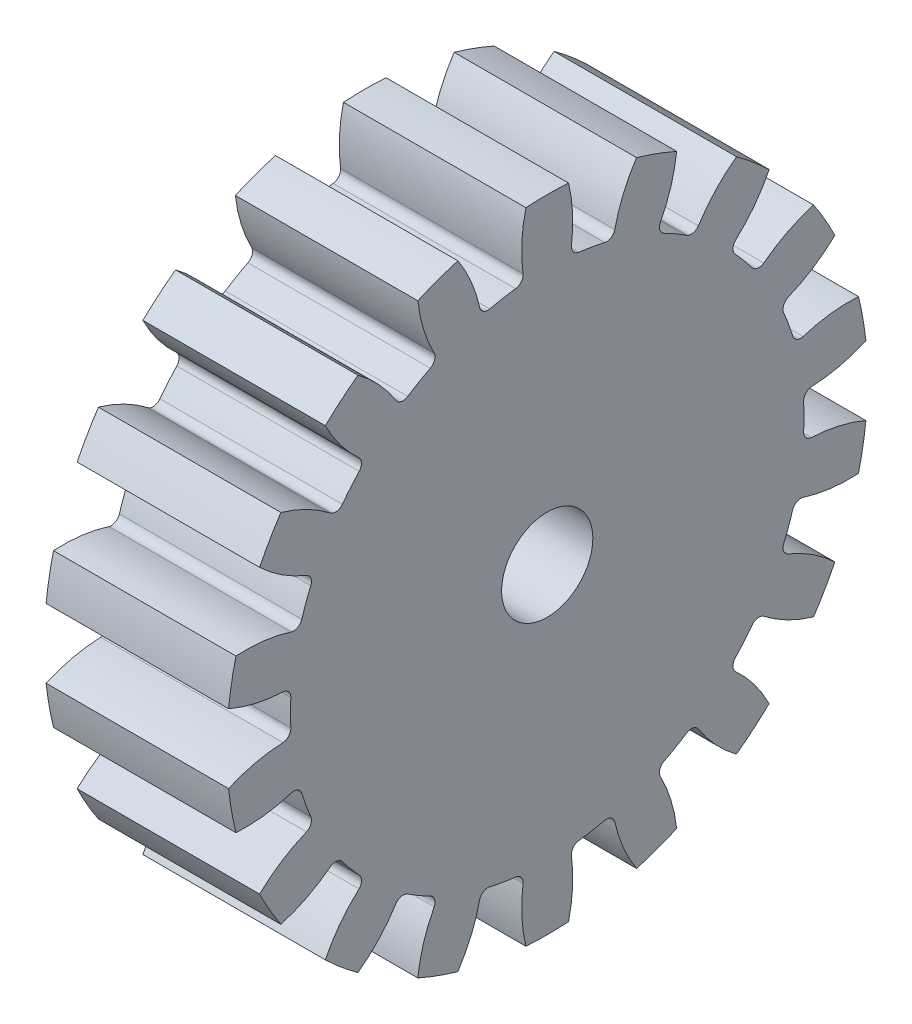
from build123d import *

# Parameters (mm, degrees)
SKETCH1_R           = 1.5
BOSS_EXTRUDE1_DEPTH = 6


with BuildPart() as part:
    # Sketch1 → Boss-Extrude1 (new body)
    with BuildSketch(Plane(origin=(-5.0626, 0, 0), x_dir=(0, -1, 0), z_dir=(-1, 0, 0))):
        with BuildLine():
            ThreePointArc((-5.090436848, -6.736072198), (-4.982381604, -6.916745301), (-5.030440693, -7.121706345))
            ThreePointArc((-5.030440693, -7.121706345), (-5.524579292, -7.900906047), (-5.865718199, -8.758197931))
            ThreePointArc((-5.865718199, -8.758197931), (-5.2705, -9.128773781), (-4.6519628, -9.458959938))
            ThreePointArc((-4.6519628, -9.458959938), (-4.079758863, -8.735097447), (-3.652358267, -7.917342605))
            ThreePointArc((-3.652358267, -7.917342605), (-3.49888634, -7.773241691), (-3.288391221, -7.776483726))
            ThreePointArc((-3.288391221, -7.776483726), (-2.887736164, -7.933989905), (-2.479573564, -8.070869278))
            ThreePointArc((-2.479573564, -8.070869278), (-2.316241008, -8.203689389), (-2.291300974, -8.412726947))
            ThreePointArc((-2.291300974, -8.412726947), (-2.489137375, -9.313940511), (-2.516491996, -10.236207747))
            ThreePointArc((-2.516491996, -10.236207747), (-1.830425441, -10.380858525), (-1.136260282, -10.479579838))
            ThreePointArc((-1.136260282, -10.479579838), (-0.846140018, -9.603666324), (-0.724203459, -8.68904852))
            ThreePointArc((-0.724203459, -8.68904852), (-0.629272437, -8.501147464), (-0.430362886, -8.43220041))
            ThreePointArc((-0.430362886, -8.43220041), (0, -8.443175704), (0.430362886, -8.43220041))
            ThreePointArc((0.430362886, -8.43220041), (0.629272437, -8.501147464), (0.724203459, -8.68904852))
            ThreePointArc((0.724203459, -8.68904852), (0.846531245, -9.60357629), (1.136260282, -10.479579838))
            ThreePointArc((1.136260282, -10.479579838), (1.830425441, -10.380858525), (2.516491996, -10.236207747))
            ThreePointArc((2.516491996, -10.236207747), (2.489535802, -9.313891307), (2.291300974, -8.412726947))
            ThreePointArc((2.291300974, -8.412726947), (2.316241008, -8.203689389), (2.479573564, -8.070869278))
            ThreePointArc((2.479573564, -8.070869278), (2.887736164, -7.933989905), (3.288391221, -7.776483726))
            ThreePointArc((3.288391221, -7.776483726), (3.49888634, -7.773241691), (3.652358267, -7.917342605))
            ThreePointArc((3.652358267, -7.917342605), (4.080095703, -8.734879036), (4.6519628, -9.458959938))
            ThreePointArc((4.6519628, -9.458959938), (5.2705, -9.128773781), (5.865718199, -8.758197931))
            ThreePointArc((5.865718199, -8.758197931), (5.524936862, -7.90072354), (5.030440693, -7.121706345))
            ThreePointArc((5.030440693, -7.121706345), (4.982381604, -6.916745301), (5.090436848, -6.736072198))
            ThreePointArc((5.090436848, -6.736072198), (5.427168729, -6.46784783), (5.749791043, -6.182808336))
            ThreePointArc((5.749791043, -6.182808336), (5.946482912, -6.107768249), (6.139984764, -6.190688324))
            ThreePointArc((6.139984764, -6.190688324), (6.821540404, -6.812626456), (7.606569949, -7.29744987))
            ThreePointArc((7.606569949, -7.29744987), (8.074874475, -6.775624194), (8.507452219, -6.223820188))
            ThreePointArc((8.507452219, -6.223820188), (7.893948997, -5.534611912), (7.162835023, -4.971702853))
            ThreePointArc((7.162835023, -4.971702853), (7.047573447, -4.795539649), (7.087318321, -4.588805397))
            ThreePointArc((7.087318321, -4.588805397), (7.312004648, -4.221587852), (7.517681208, -3.843395012))
            ThreePointArc((7.517681208, -3.843395012), (7.676845884, -3.705607815), (7.887038483, -3.717345667))
            ThreePointArc((7.887038483, -3.717345667), (8.740206657, -4.068670582), (9.643712501, -4.255759649))
            ThreePointArc((9.643712501, -4.255759649), (9.905299916, -3.605234331), (10.123061945, -2.938757877))
            ThreePointArc((10.123061945, -2.938757877), (9.310834381, -2.500944406), (8.431285738, -2.222038623))
            ThreePointArc((8.431285738, -2.222038623), (8.26272392, -2.09592114), (8.229364607, -1.888060942))
            ThreePointArc((8.229364607, -1.888060942), (8.314904893, -1.466142075), (8.378828069, -1.040411528))
            ThreePointArc((8.378828069, -1.040411528), (8.481267944, -0.85649639), (8.68279896, -0.79563626))
            ThreePointArc((8.68279896, -0.79563626), (9.604674995, -0.833972989), (10.517681, -0.700762007))
            ThreePointArc((10.517681, -0.700762007), (10.541, 0), (10.517681, 0.700762007))
            ThreePointArc((10.517681, 0.700762007), (9.604695725, 0.834373906), (8.68279896, 0.79563626))
            ThreePointArc((8.68279896, 0.79563626), (8.481267944, 0.85649639), (8.378828069, 1.040411528))
            ThreePointArc((8.378828069, 1.040411528), (8.314904893, 1.466142075), (8.229364607, 1.888060942))
            ThreePointArc((8.229364607, 1.888060942), (8.26272392, 2.09592114), (8.431285738, 2.222038623))
            ThreePointArc((8.431285738, 2.222038623), (9.310677779, 2.501314055), (10.123061945, 2.938757877))
            ThreePointArc((10.123061945, 2.938757877), (9.905299916, 3.605234331), (9.643712501, 4.255759649))
            ThreePointArc((9.643712501, 4.255759649), (8.740089015, 4.069054411), (7.887038483, 3.717345667))
            ThreePointArc((7.887038483, 3.717345667), (7.676845884, 3.705607815), (7.517681208, 3.843395012))
            ThreePointArc((7.517681208, 3.843395012), (7.312004648, 4.221587852), (7.087318321, 4.588805397))
            ThreePointArc((7.087318321, 4.588805397), (7.047573447, 4.795539649), (7.162835023, 4.971702853))
            ThreePointArc((7.162835023, 4.971702853), (7.893675412, 5.534905708), (8.507452219, 6.223820188))
            ThreePointArc((8.507452219, 6.223820188), (8.074874475, 6.775624194), (7.606569949, 7.29744987))
            ThreePointArc((7.606569949, 7.29744987), (6.821298579, 6.812946901), (6.139984764, 6.190688324))
            ThreePointArc((6.139984764, 6.190688324), (5.946482912, 6.107768249), (5.749791043, 6.182808336))
            ThreePointArc((5.749791043, 6.182808336), (5.427168729, 6.46784783), (5.090436848, 6.736072198))
            ThreePointArc((5.090436848, 6.736072198), (4.982381604, 6.916745301), (5.030440693, 7.121706345))
            ThreePointArc((5.030440693, 7.121706345), (5.524579292, 7.900906047), (5.865718199, 8.758197931))
            ThreePointArc((5.865718199, 8.758197931), (5.2705, 9.128773781), (4.6519628, 9.458959938))
            ThreePointArc((4.6519628, 9.458959938), (4.079758863, 8.735097447), (3.652358267, 7.917342605))
            ThreePointArc((3.652358267, 7.917342605), (3.49888634, 7.773241691), (3.288391221, 7.776483726))
            ThreePointArc((3.288391221, 7.776483726), (2.887736164, 7.933989905), (2.479573564, 8.070869278))
            ThreePointArc((2.479573564, 8.070869278), (2.316241008, 8.203689389), (2.291300974, 8.412726947))
            ThreePointArc((2.291300974, 8.412726947), (2.489137375, 9.313940511), (2.516491996, 10.236207747))
            ThreePointArc((2.516491996, 10.236207747), (1.830425441, 10.380858525), (1.136260282, 10.479579838))
            ThreePointArc((1.136260282, 10.479579838), (0.846140018, 9.603666324), (0.724203459, 8.68904852))
            ThreePointArc((0.724203459, 8.68904852), (0.629272437, 8.501147464), (0.430362886, 8.43220041))
            ThreePointArc((0.430362886, 8.43220041), (0, 8.443175704), (-0.430362886, 8.43220041))
            ThreePointArc((-0.430362886, 8.43220041), (-0.629272437, 8.501147464), (-0.724203459, 8.68904852))
            ThreePointArc((-0.724203459, 8.68904852), (-0.846531245, 9.60357629), (-1.136260282, 10.479579838))
            ThreePointArc((-1.136260282, 10.479579838), (-1.830425441, 10.380858525), (-2.516491996, 10.236207747))
            ThreePointArc((-2.516491996, 10.236207747), (-2.489535802, 9.313891307), (-2.291300974, 8.412726947))
            ThreePointArc((-2.291300974, 8.412726947), (-2.316241008, 8.203689389), (-2.479573564, 8.070869278))
            ThreePointArc((-2.479573564, 8.070869278), (-2.887736164, 7.933989905), (-3.288391221, 7.776483726))
            ThreePointArc((-3.288391221, 7.776483726), (-3.49888634, 7.773241691), (-3.652358267, 7.917342605))
            ThreePointArc((-3.652358267, 7.917342605), (-4.080095703, 8.734879036), (-4.6519628, 9.458959938))
            ThreePointArc((-4.6519628, 9.458959938), (-5.2705, 9.128773781), (-5.865718199, 8.758197931))
            ThreePointArc((-5.865718199, 8.758197931), (-5.524936862, 7.90072354), (-5.030440693, 7.121706345))
            ThreePointArc((-5.030440693, 7.121706345), (-4.982381604, 6.916745301), (-5.090436848, 6.736072198))
            ThreePointArc((-5.090436848, 6.736072198), (-5.427168729, 6.46784783), (-5.749791043, 6.182808336))
            ThreePointArc((-5.749791043, 6.182808336), (-5.946482912, 6.107768249), (-6.139984764, 6.190688324))
            ThreePointArc((-6.139984764, 6.190688324), (-6.821540404, 6.812626456), (-7.606569949, 7.29744987))
            ThreePointArc((-7.606569949, 7.29744987), (-8.074874475, 6.775624194), (-8.507452219, 6.223820188))
            ThreePointArc((-8.507452219, 6.223820188), (-7.893948997, 5.534611912), (-7.162835023, 4.971702853))
            ThreePointArc((-7.162835023, 4.971702853), (-7.047573447, 4.795539649), (-7.087318321, 4.588805397))
            ThreePointArc((-7.087318321, 4.588805397), (-7.312004648, 4.221587852), (-7.517681208, 3.843395012))
            ThreePointArc((-7.517681208, 3.843395012), (-7.676845884, 3.705607815), (-7.887038483, 3.717345667))
            ThreePointArc((-7.887038483, 3.717345667), (-8.740206657, 4.068670582), (-9.643712501, 4.255759649))
            ThreePointArc((-9.643712501, 4.255759649), (-9.905299916, 3.605234331), (-10.123061945, 2.938757877))
            ThreePointArc((-10.123061945, 2.938757877), (-9.310834381, 2.500944406), (-8.431285738, 2.222038623))
            ThreePointArc((-8.431285738, 2.222038623), (-8.26272392, 2.09592114), (-8.229364607, 1.888060942))
            ThreePointArc((-8.229364607, 1.888060942), (-8.314904893, 1.466142075), (-8.378828069, 1.040411528))
            ThreePointArc((-8.378828069, 1.040411528), (-8.481267944, 0.85649639), (-8.68279896, 0.79563626))
            ThreePointArc((-8.68279896, 0.79563626), (-9.604674995, 0.833972989), (-10.517681, 0.700762007))
            ThreePointArc((-10.517681, 0.700762007), (-10.541, 0), (-10.517681, -0.700762007))
            ThreePointArc((-10.517681, -0.700762007), (-9.604695725, -0.834373906), (-8.68279896, -0.79563626))
            ThreePointArc((-8.68279896, -0.79563626), (-8.481267944, -0.85649639), (-8.378828069, -1.040411528))
            ThreePointArc((-8.378828069, -1.040411528), (-8.314904893, -1.466142075), (-8.229364607, -1.888060942))
            ThreePointArc((-8.229364607, -1.888060942), (-8.26272392, -2.09592114), (-8.431285738, -2.222038623))
            ThreePointArc((-8.431285738, -2.222038623), (-9.310677779, -2.501314055), (-10.123061945, -2.938757877))
            ThreePointArc((-10.123061945, -2.938757877), (-9.905299916, -3.605234331), (-9.643712501, -4.255759649))
            ThreePointArc((-9.643712501, -4.255759649), (-8.740089015, -4.069054411), (-7.887038483, -3.717345667))
            ThreePointArc((-7.887038483, -3.717345667), (-7.676845884, -3.705607815), (-7.517681208, -3.843395012))
            ThreePointArc((-7.517681208, -3.843395012), (-7.312004648, -4.221587852), (-7.087318321, -4.588805397))
            ThreePointArc((-7.087318321, -4.588805397), (-7.047573447, -4.795539649), (-7.162835023, -4.971702853))
            ThreePointArc((-7.162835023, -4.971702853), (-7.893675412, -5.534905708), (-8.507452219, -6.223820188))
            ThreePointArc((-8.507452219, -6.223820188), (-8.074874475, -6.775624194), (-7.606569949, -7.29744987))
            ThreePointArc((-7.606569949, -7.29744987), (-6.821298579, -6.812946901), (-6.139984764, -6.190688324))
            ThreePointArc((-6.139984764, -6.190688324), (-5.946482912, -6.107768249), (-5.749791043, -6.182808336))
            ThreePointArc((-5.749791043, -6.182808336), (-5.427168729, -6.46784783), (-5.090436848, -6.736072198))
        make_face()
        Circle(SKETCH1_R, mode=Mode.SUBTRACT)
    extrude(amount=-BOSS_EXTRUDE1_DEPTH)


solid = part.part
